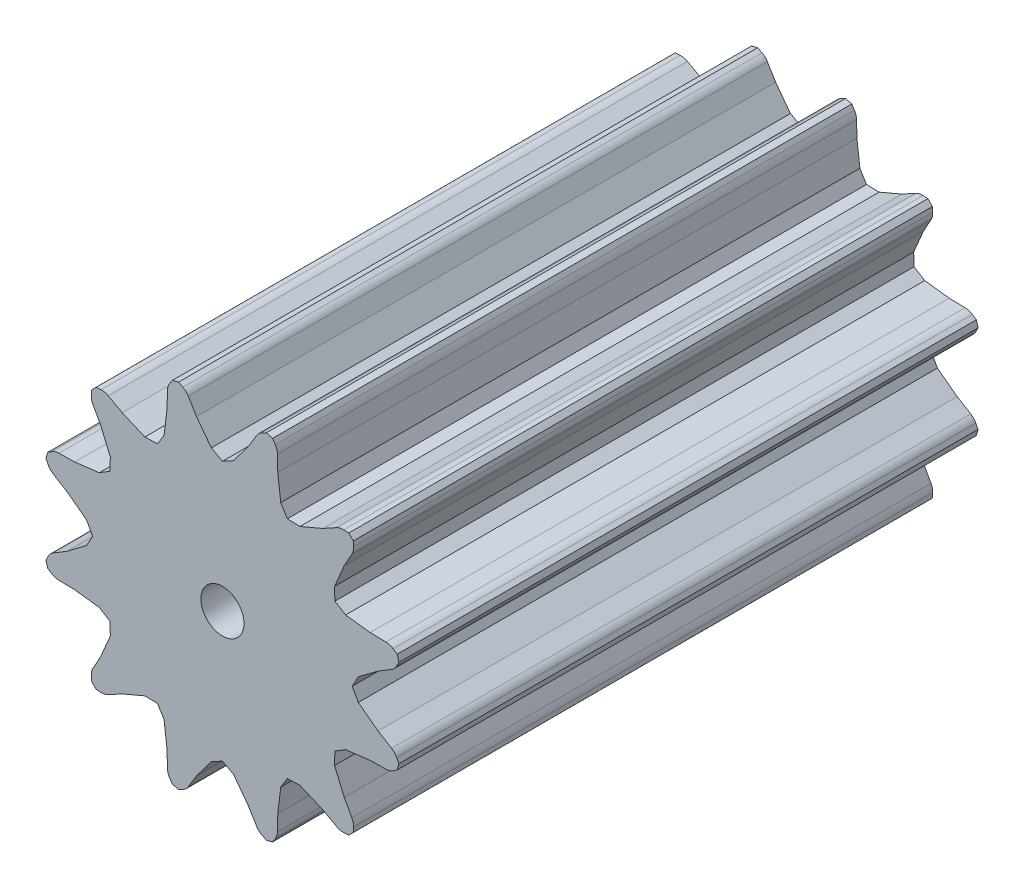
from build123d import *

# Parameters (mm, degrees)
SKETCH1_R               = 13.5
BOSS_EXTRUDE1_DEPTH     = 43
CUT_EXTRUDE1_DEPTH      = 48.047847985
CIRPATTERN1_COUNT       = 12
FILLET1_R               = 1
CUT_EXTRUDE2_DEPTH      = 47.821162925
CUT_EXTRUDE2_DEPTH_BACK = 47.821162925
SKETCH4_R               = 1.6


with BuildPart() as part:
    # Sketch1 → Boss-Extrude1 (new body)
    with BuildSketch(Plane.XY):
        Circle(SKETCH1_R)
    extrude(amount=BOSS_EXTRUDE1_DEPTH)

    # Sketch2 → Cut-Extrude1 (cut, through all)
    with BuildSketch(Plane.XY):
        Polygon((0, 9.63964058), (-0.823535161, 10.08799458), (-1.92504587, 11.552790759), (-2.682696002, 12.806911664), (-3.261801829, 13.100024764), (0, 19.238413614), (3.261801829, 13.100024764), (2.682696002, 12.806911664), (1.92504587, 11.552790759), (0.823535161, 10.08799458), align=None)
    cut_extrude1 = extrude(amount=CUT_EXTRUDE1_DEPTH, mode=Mode.SUBTRACT)

    # CirPattern1: Cut-Extrude1 ×12 about axis
    cirpattern1_axis = Axis((0, 0, 43), (0, 0, -1))
    for i in range(1, CIRPATTERN1_COUNT):
        add(cut_extrude1.rotate(cirpattern1_axis, i * 360 / CIRPATTERN1_COUNT), mode=Mode.SUBTRACT)

    # Fillet1
    fillet1_edges = [part.edges().sort_by_distance(p)[0] for p in [
        (-8.726738721, 9.749762844, 21.5),
        (-9.749762844, 8.726738721, 21.5),
        (-12.432458846, 4.080172944, 21.5),
        (-12.806911664, 2.682696002, 21.5),
        (-12.806911664, -2.682696002, 21.5),
        (-12.432458846, -4.080172944, 21.5),
        (-9.749762844, -8.726738721, 21.5),
        (-8.726738721, -9.749762844, 21.5),
        (-4.080172944, -12.432458846, 21.5),
        (-2.682696002, -12.806911664, 21.5),
        (2.682696002, -12.806911664, 21.5),
        (4.080172944, -12.432458846, 21.5),
        (8.726738721, -9.749762844, 21.5),
        (12.432458846, -4.080172944, 21.5),
        (9.749762844, -8.726738721, 21.5),
        (12.806911664, -2.682696002, 21.5),
        (12.806911664, 2.682696002, 21.5),
        (12.432458846, 4.080172944, 21.5),
        (9.749762844, 8.726738721, 21.5),
        (4.080172944, 12.432458846, 21.5),
        (8.726738721, 9.749762844, 21.5),
        (2.682696002, 12.806911664, 21.5),
        (-2.682696002, 12.806911664, 21.5),
        (-4.080172944, 12.432458846, 21.5),
    ]]
    fillet(fillet1_edges, radius=FILLET1_R)

    # Sketch4 → Cut-Extrude2 (cut, two sides: drawn at the far end of the back side and taken through both)
    with BuildSketch(Plane.XY.offset(43).offset(-CUT_EXTRUDE2_DEPTH_BACK)):
        Circle(SKETCH4_R)
    extrude(amount=CUT_EXTRUDE2_DEPTH + CUT_EXTRUDE2_DEPTH_BACK, mode=Mode.SUBTRACT)


solid = part.part
